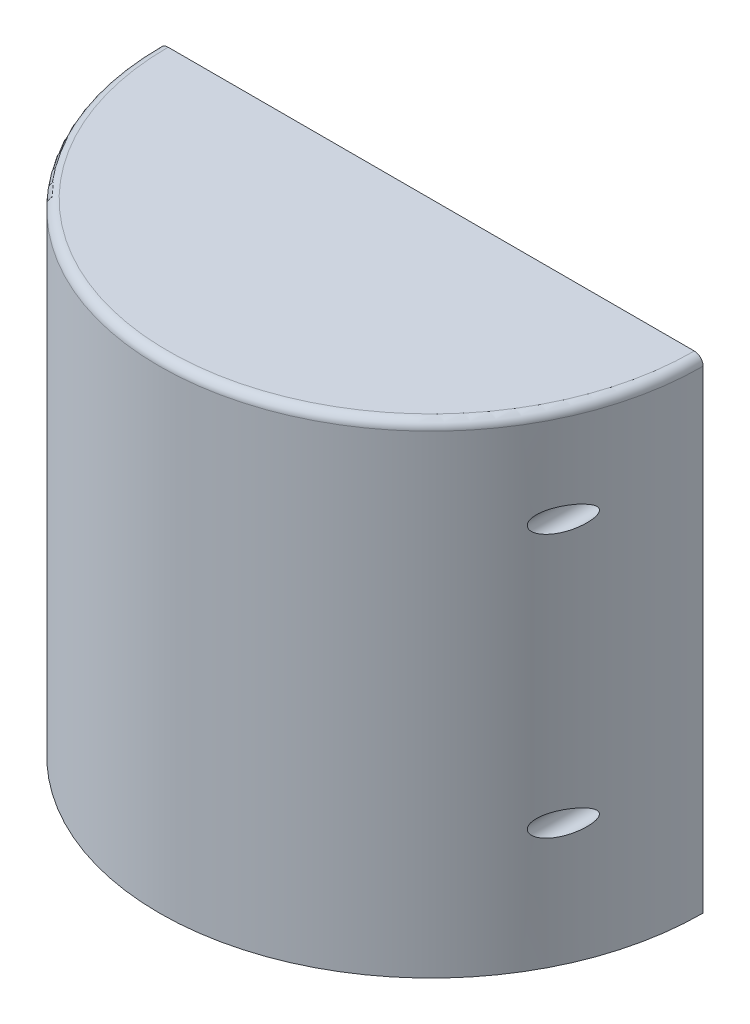
from build123d import *

# Parameters (mm, degrees)
EXTRUDE_1_DEPTH     = 55
EXTRUDE_5_REACH     = 72.335
SKETCH_12_R         = 3
SKETCH_16_R         = 1.3
CUT_EXTRUDE_2_DEPTH = 71.334913173
EXTRUDE_START       = -3
EXTRUDE_6_DEPTH     = 3
FILLET_1_R          = 1


with BuildPart() as part:
    # Эскиз1 → Бобышка-Вытянуть1 (new body)
    with BuildSketch(Plane(origin=(0, 0, 0), x_dir=(1, 0, 0), z_dir=(0, 1, 0))):
        with BuildLine():
            Line((-31, 0), (-28, 0))
            ThreePointArc((-28, 0), (0, -28), (28, 0))
            Line((28, 0), (31, 0))
            ThreePointArc((31, 0), (0, -31), (-31, 0))
        make_face()
    extrude(amount=EXTRUDE_1_DEPTH)

    # Эскиз12 → Бобышка-Вытянуть5 (add, up to next)
    with BuildSketch(Plane(origin=(0, 0, 0), x_dir=(-1, 0, 0), z_dir=(0, 0, -1)), mode=Mode.PRIVATE) as extrude_5_sk1:
        with Locations((28, 44)):
            Circle(SKETCH_12_R)
    extrude_5_tool1 = extrude(extrude_5_sk1.sketch, amount=-EXTRUDE_5_REACH, mode=Mode.PRIVATE) - part.part
    # Эскиз12 → Бобышка-Вытянуть5 (add, up to next)
    with BuildSketch(Plane(origin=(0, 0, 0), x_dir=(-1, 0, 0), z_dir=(0, 0, -1)), mode=Mode.PRIVATE) as extrude_5_sk2:
        with Locations((28, 14)):
            Circle(SKETCH_12_R)
    extrude_5_tool2 = extrude(extrude_5_sk2.sketch, amount=-EXTRUDE_5_REACH, mode=Mode.PRIVATE) - part.part
    # Эскиз12 → Бобышка-Вытянуть5 (add, up to next)
    with BuildSketch(Plane(origin=(0, 0, 0), x_dir=(-1, 0, 0), z_dir=(0, 0, -1)), mode=Mode.PRIVATE) as extrude_5_sk3:
        with Locations((-28, 44)):
            Circle(SKETCH_12_R)
    extrude_5_tool3 = extrude(extrude_5_sk3.sketch, amount=-EXTRUDE_5_REACH, mode=Mode.PRIVATE) - part.part
    # Эскиз12 → Бобышка-Вытянуть5 (add, up to next)
    with BuildSketch(Plane(origin=(0, 0, 0), x_dir=(-1, 0, 0), z_dir=(0, 0, -1)), mode=Mode.PRIVATE) as extrude_5_sk4:
        with Locations((-28, 14)):
            Circle(SKETCH_12_R)
    extrude_5_tool4 = extrude(extrude_5_sk4.sketch, amount=-EXTRUDE_5_REACH, mode=Mode.PRIVATE) - part.part
    add(extrude_5_tool1.solids().sort_by_distance((-28, 44, 0))[0])
    add(extrude_5_tool2.solids().sort_by_distance((-28, 14, 0))[0])
    add(extrude_5_tool3.solids().sort_by_distance((28, 44, 0))[0])
    add(extrude_5_tool4.solids().sort_by_distance((28, 14, 0))[0])

    # Эскиз16 → Вырез-Вытянуть2 (cut, through all)
    with BuildSketch(Plane(origin=(0, 0, 0), x_dir=(-1, 0, 0), z_dir=(0, 0, -1))):
        with Locations((28, 44)):
            Circle(SKETCH_16_R)
        with Locations((28, 14)):
            Circle(SKETCH_16_R)
        with Locations((-28, 14)):
            Circle(SKETCH_16_R)
        with Locations((-28, 44)):
            Circle(SKETCH_16_R)
    extrude(amount=-CUT_EXTRUDE_2_DEPTH, mode=Mode.SUBTRACT)

    # Эскиз2 → Бобышка-Вытянуть6 (add)
    with BuildSketch(Plane(origin=(0, 55, 0), x_dir=(1, 0, 0), z_dir=(0, 1, 0)).offset(EXTRUDE_START)):
        with BuildLine():
            Line((-31, 0), (31, 0))
            ThreePointArc((31, 0), (0, -31), (-31, 0))
        make_face()
    extrude(amount=EXTRUDE_6_DEPTH)

    # Скругление1
    fillet_1_edges = [part.edges().sort_by_distance(p)[0] for p in [
        (0, 55, 31),
    ]]
    fillet(fillet_1_edges, radius=FILLET_1_R)


solid = part.part
